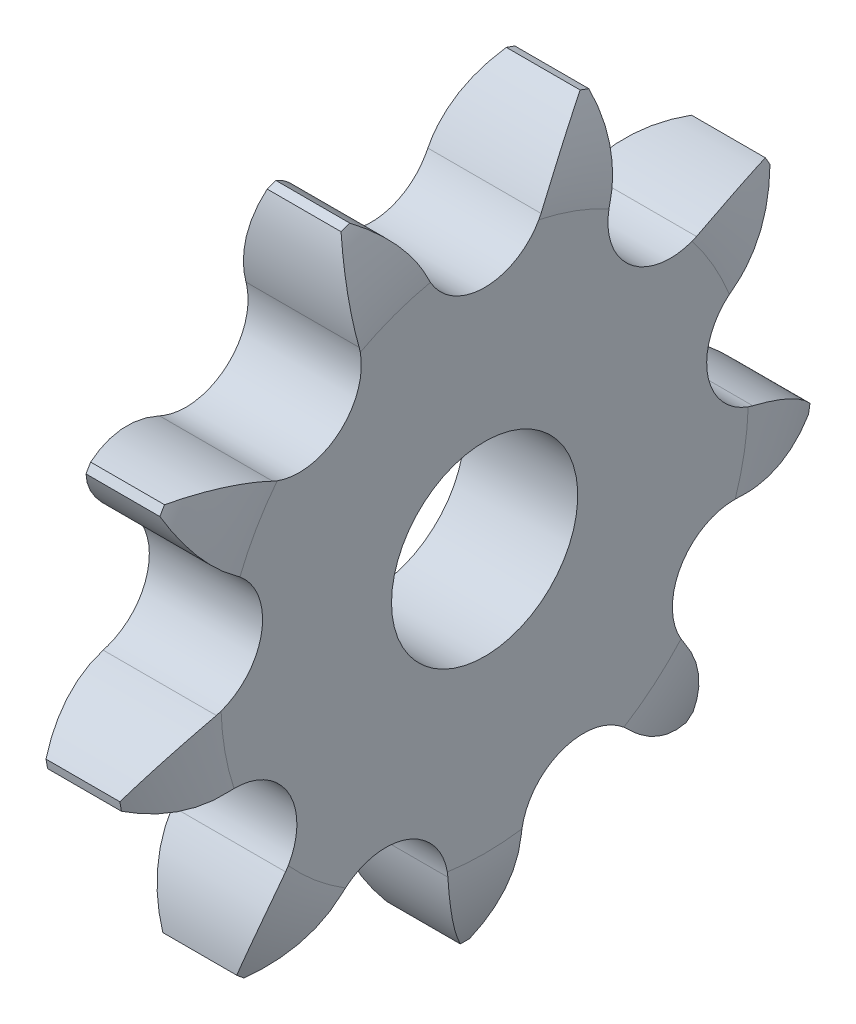
from build123d import *

# Parameters (mm, degrees)
TOOTHCUT_DEPTH  = 33.685942836
TEETHCUTS_COUNT = 9
TEETHCUTS_ANGLE = 320
BORSKE_R        = 6
BORE_DEPTH      = 9.5005


with BuildPart() as part:
    # BasProSke → Base-Revolve (revolve)
    with BuildSketch(Plane(origin=(0, 0, 0), x_dir=(1, 0, 0), z_dir=(0, 1, 0))):
        with BuildLine():
            Line((0, 0), (0, 16.992856303))
            ThreePointArc((0, 16.992856303), (0.321571182, 19.832662635), (1.27, 22.528657961))
            Line((1.27, 22.528657961), (6.03, 22.528657961))
            ThreePointArc((6.03, 22.528657961), (6.978428818, 19.832662635), (7.3, 16.992856303))
            Line((7.3, 16.992856303), (7.3, 0))
            Line((7.3, 0), (0, 0))
        make_face()
    revolve(axis=Axis((-10, 0, 0), (1, 0, 0)))

    # TooCutSke → ToothCut (cut, through all)
    with BuildSketch(Plane(origin=(0, 0, 0), x_dir=(0, 0, -1), z_dir=(1, 0, 0))):
        with BuildLine():
            ThreePointArc((3.638599188, 16.909201295), (5.440645741, 19.594585844), (7.97480479, 21.603739863))
            ThreePointArc((7.97480479, 21.603739863), (0, 23.028657961), (-7.97480479, 21.603739863))
            ThreePointArc((-7.97480479, 21.603739863), (-5.440645741, 19.594585844), (-3.638599188, 16.909201295))
            ThreePointArc((-3.638599188, 16.909201295), (0, 14.591157961), (3.638599188, 16.909201295))
        make_face()
    toothcut = extrude(amount=TOOTHCUT_DEPTH, mode=Mode.SUBTRACT)

    # TeethCuts: ToothCut ×9 about axis
    teethcuts_axis = Axis((-10, 0, 0), (1, 0, 0))
    for i in range(1, TEETHCUTS_COUNT):
        add(toothcut.rotate(teethcuts_axis, i * TEETHCUTS_ANGLE / (TEETHCUTS_COUNT - 1)), mode=Mode.SUBTRACT)

    # BorSke → Bore (cut, symmetric)
    with BuildSketch(Plane(origin=(0, 0, 0), x_dir=(0, 0, -1), z_dir=(1, 0, 0))):
        Circle(BORSKE_R)
    extrude(amount=BORE_DEPTH, both=True, mode=Mode.SUBTRACT)


solid = part.part
